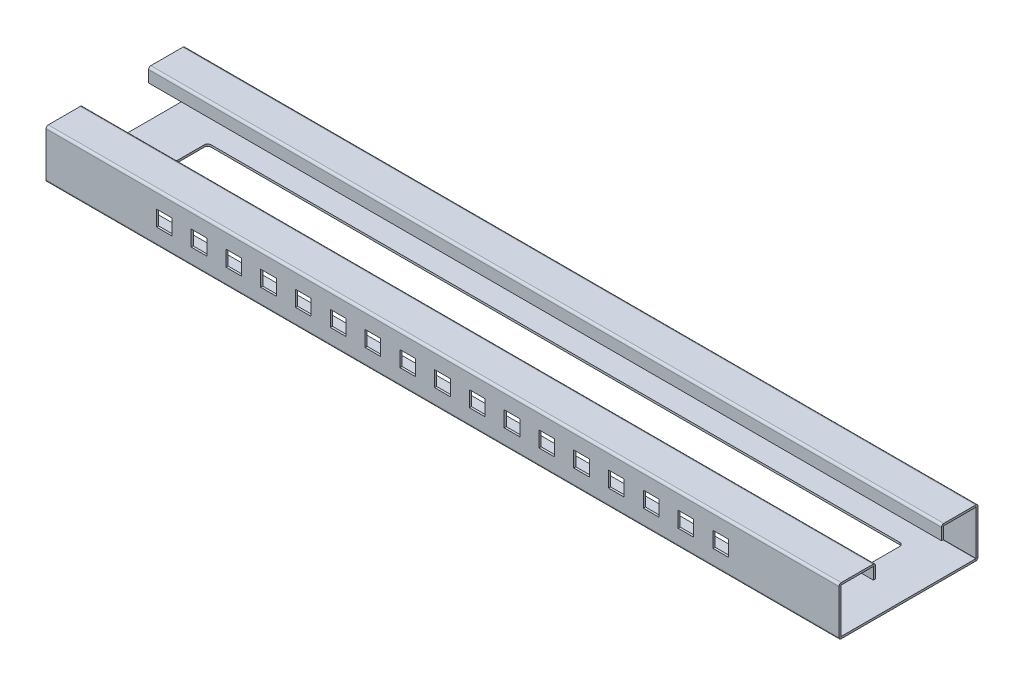
from build123d import *

# Parameters (mm, degrees)
SKETCH_1_W                         = 456
SKETCH_1_H                         = 80
SM_BASE_FLANGE_1_DEPTH             = 1.2
SM_EDGE_FLANGE_1_STRIP_W           = 5
SM_EDGE_FLANGE_1_STRIP_H           = 1.2
SM_EDGE_FLANGE_1_STRIP_CUT_DEPTH   = 456
SM_EDGE_FLANGE_1_STRIP_2_W         = 5
SM_EDGE_FLANGE_1_STRIP_2_H         = 1.2
SM_EDGE_FLANGE_1_STRIP_CUT_2_DEPTH = 456
SM_EDGE_FLANGE_1_DEPTH             = 456
SM_EDGE_FLANGE_1_BEND_DEPTH        = 456
SM_EDGE_FLANGE_2_STRIP_W           = 5
SM_EDGE_FLANGE_2_STRIP_H           = 1.2
SM_EDGE_FLANGE_2_STRIP_CUT_DEPTH   = 456
SM_EDGE_FLANGE_2_STRIP_2_W         = 5
SM_EDGE_FLANGE_2_STRIP_2_H         = 1.2
SM_EDGE_FLANGE_2_STRIP_CUT_2_DEPTH = 456
SM_EDGE_FLANGE_2_DEPTH             = 456
SM_EDGE_FLANGE_2_BEND_DEPTH        = 456
SKETCH_30_W                        = 400
SKETCH_30_H                        = 50
CUT_EXTRUDE_1_DEPTH                = 10
SM_EDGE_FLANGE_3_STRIP_W           = 5
SM_EDGE_FLANGE_3_STRIP_H           = 1.2
SM_EDGE_FLANGE_3_STRIP_CUT_DEPTH   = 456
SM_EDGE_FLANGE_3_STRIP_2_W         = 5
SM_EDGE_FLANGE_3_STRIP_2_H         = 1.2
SM_EDGE_FLANGE_3_STRIP_CUT_2_DEPTH = 456
SM_EDGE_FLANGE_3_DEPTH             = 456
SM_EDGE_FLANGE_3_BEND_DEPTH        = 456
FILLET_1_R                         = 2
SKETCH_40_W                        = 9
SKETCH_40_H                        = 9
CUT_EXTRUDE_2_DEPTH                = 244.109522644
PATTERN_LINEAR_1_COUNT             = 9
PATTERN_LINEAR_1_PITCH             = 20
PATTERN_LINEAR_1_COL_COUNT         = 9
PATTERN_LINEAR_1_COL_PITCH         = 20


# Sheet-metal steps are written as plain solids
with BuildPart() as part:
    # Sketch 1 → 基体-法兰1 (new body)
    with BuildSketch(Plane(origin=(0, 0, 0), x_dir=(1, 0, 0), z_dir=(0, 1, 0))):
        Rectangle(SKETCH_1_W, SKETCH_1_H)
    extrude(amount=-SM_BASE_FLANGE_1_DEPTH)

    # 边线-法兰1 strip (across the edge) → 边线-法兰1 strip cut (cut)
    with BuildSketch(Plane(origin=(-228, 0, 40), x_dir=(0, 0, -1), z_dir=(1, 0, 0))):
        with Locations((-1.2, -0.6)):
            Rectangle(SM_EDGE_FLANGE_1_STRIP_W, SM_EDGE_FLANGE_1_STRIP_H)
    extrude(amount=SM_EDGE_FLANGE_1_STRIP_CUT_DEPTH, mode=Mode.SUBTRACT)

    # 边线-法兰1 strip 2 (across the edge) → 边线-法兰1 strip cut 2 (cut)
    with BuildSketch(Plane(origin=(228, 0, -40), x_dir=(0, 0, 1), z_dir=(-1, 0, 0))):
        with Locations((-1.2, -0.6)):
            Rectangle(SM_EDGE_FLANGE_1_STRIP_2_W, SM_EDGE_FLANGE_1_STRIP_2_H)
    extrude(amount=SM_EDGE_FLANGE_1_STRIP_CUT_2_DEPTH, mode=Mode.SUBTRACT)

    # 边线-法兰1 section (across the edge) → 边线-法兰1 (add)
    with BuildSketch(Plane(origin=(-228, 0, 40), x_dir=(0, 0, -1), z_dir=(1, 0, 0))):
        with BuildLine():
            Line((0, 0.1), (0, 26.8))
            Line((0, 26.8), (1.2, 26.8))
            Line((1.2, 26.8), (1.2, 0.1))
            ThreePointArc((1.2, 0.1), (1.229289322, 0.029289322), (1.3, 0))
            Line((1.3, 0), (1.3, -1.2))
            ThreePointArc((1.3, -1.2), (0.380761184, -0.819238816), (0, 0.1))
        make_face()
    extrude(amount=SM_EDGE_FLANGE_1_DEPTH)

    # 边线-法兰1 section 2 (across the edge) → 边线-法兰1 bend (add)
    with BuildSketch(Plane(origin=(228, 0, -40), x_dir=(0, 0, 1), z_dir=(-1, 0, 0))):
        with BuildLine():
            Line((0, 0.1), (0, 26.8))
            Line((0, 26.8), (1.2, 26.8))
            Line((1.2, 26.8), (1.2, 0.1))
            ThreePointArc((1.2, 0.1), (1.229289322, 0.029289322), (1.3, 0))
            Line((1.3, 0), (1.3, -1.2))
            ThreePointArc((1.3, -1.2), (0.380761184, -0.819238816), (0, 0.1))
        make_face()
    extrude(amount=SM_EDGE_FLANGE_1_BEND_DEPTH)

    # 边线-法兰2 strip (across the edge) → 边线-法兰2 strip cut (cut)
    with BuildSketch(Plane(origin=(-228, 26.8, 38.8), x_dir=(0, -1, 0), z_dir=(1, 0, 0))):
        with Locations((-1.2, -0.6)):
            Rectangle(SM_EDGE_FLANGE_2_STRIP_W, SM_EDGE_FLANGE_2_STRIP_H)
    extrude(amount=SM_EDGE_FLANGE_2_STRIP_CUT_DEPTH, mode=Mode.SUBTRACT)

    # 边线-法兰2 strip 2 (across the edge) → 边线-法兰2 strip cut 2 (cut)
    with BuildSketch(Plane(origin=(228, 26.8, -38.8), x_dir=(0, -1, 0), z_dir=(-1, 0, 0))):
        with Locations((-1.2, -0.6)):
            Rectangle(SM_EDGE_FLANGE_2_STRIP_2_W, SM_EDGE_FLANGE_2_STRIP_2_H)
    extrude(amount=SM_EDGE_FLANGE_2_STRIP_CUT_2_DEPTH, mode=Mode.SUBTRACT)

    # 边线-法兰2 section (across the edge) → 边线-法兰2 (add)
    with BuildSketch(Plane(origin=(-228, 26.8, 38.8), x_dir=(0, -1, 0), z_dir=(1, 0, 0))):
        with BuildLine():
            Line((0, 0.1), (0, 19.8))
            Line((0, 19.8), (1.2, 19.8))
            Line((1.2, 19.8), (1.2, 0.1))
            ThreePointArc((1.2, 0.1), (1.229289322, 0.029289322), (1.3, 0))
            Line((1.3, 0), (1.3, -1.2))
            ThreePointArc((1.3, -1.2), (0.380761184, -0.819238816), (0, 0.1))
        make_face()
    extrude(amount=SM_EDGE_FLANGE_2_DEPTH)

    # 边线-法兰2 section 2 (across the edge) → 边线-法兰2 bend (add)
    with BuildSketch(Plane(origin=(228, 26.8, -38.8), x_dir=(0, -1, 0), z_dir=(-1, 0, 0))):
        with BuildLine():
            Line((0, 0.1), (0, 19.8))
            Line((0, 19.8), (1.2, 19.8))
            Line((1.2, 19.8), (1.2, 0.1))
            ThreePointArc((1.2, 0.1), (1.229289322, 0.029289322), (1.3, 0))
            Line((1.3, 0), (1.3, -1.2))
            ThreePointArc((1.3, -1.2), (0.380761184, -0.819238816), (0, 0.1))
        make_face()
    extrude(amount=SM_EDGE_FLANGE_2_BEND_DEPTH)

    # 草图30 → 切除-拉伸1 (cut)
    with BuildSketch(Plane(origin=(0, 0, 0), x_dir=(1, 0, 0), z_dir=(0, 1, 0))):
        Rectangle(SKETCH_30_W, SKETCH_30_H)
    extrude(amount=-CUT_EXTRUDE_1_DEPTH, mode=Mode.SUBTRACT)

    # 边线-法兰3 strip (across the edge) → 边线-法兰3 strip cut (cut)
    with BuildSketch(Plane(origin=(-228, 25.6, 19), x_dir=(0, 0, 1), z_dir=(1, 0, 0))):
        with Locations((-1.2, -0.6)):
            Rectangle(SM_EDGE_FLANGE_3_STRIP_W, SM_EDGE_FLANGE_3_STRIP_H)
    extrude(amount=SM_EDGE_FLANGE_3_STRIP_CUT_DEPTH, mode=Mode.SUBTRACT)

    # 边线-法兰3 strip 2 (across the edge) → 边线-法兰3 strip cut 2 (cut)
    with BuildSketch(Plane(origin=(228, 25.6, -19), x_dir=(0, 0, -1), z_dir=(-1, 0, 0))):
        with Locations((-1.2, -0.6)):
            Rectangle(SM_EDGE_FLANGE_3_STRIP_2_W, SM_EDGE_FLANGE_3_STRIP_2_H)
    extrude(amount=SM_EDGE_FLANGE_3_STRIP_CUT_2_DEPTH, mode=Mode.SUBTRACT)

    # 边线-法兰3 section (across the edge) → 边线-法兰3 (add)
    with BuildSketch(Plane(origin=(-228, 25.6, 19), x_dir=(0, 0, 1), z_dir=(1, 0, 0))):
        with BuildLine():
            Line((0, 0.1), (0, 6.8))
            Line((0, 6.8), (1.2, 6.8))
            Line((1.2, 6.8), (1.2, 0.1))
            ThreePointArc((1.2, 0.1), (1.229289322, 0.029289322), (1.3, 0))
            Line((1.3, 0), (1.3, -1.2))
            ThreePointArc((1.3, -1.2), (0.380761184, -0.819238816), (0, 0.1))
        make_face()
    extrude(amount=SM_EDGE_FLANGE_3_DEPTH)

    # 边线-法兰3 section 2 (across the edge) → 边线-法兰3 bend (add)
    with BuildSketch(Plane(origin=(228, 25.6, -19), x_dir=(0, 0, -1), z_dir=(-1, 0, 0))):
        with BuildLine():
            Line((0, 0.1), (0, 6.8))
            Line((0, 6.8), (1.2, 6.8))
            Line((1.2, 6.8), (1.2, 0.1))
            ThreePointArc((1.2, 0.1), (1.229289322, 0.029289322), (1.3, 0))
            Line((1.3, 0), (1.3, -1.2))
            ThreePointArc((1.3, -1.2), (0.380761184, -0.819238816), (0, 0.1))
        make_face()
    extrude(amount=SM_EDGE_FLANGE_3_BEND_DEPTH)

    # 圆角1
    fillet_1_edges = [part.edges().sort_by_distance(p)[0] for p in [
        (200, -0.6, -25),
        (200, -0.6, 25),
        (-200, -0.6, 25),
        (-200, -0.6, -25),
    ]]
    fillet(fillet_1_edges, radius=FILLET_1_R)

    # 草图40 → 切除-拉伸2 (cut, through all)
    with BuildSketch(Plane(origin=(0, 0, -40), x_dir=(-1, 0, 0), z_dir=(0, 0, -1))):
        with Locations((0, 12.8)):
            Rectangle(SKETCH_40_W, SKETCH_40_H)
    cut_extrude_2 = extrude(amount=-CUT_EXTRUDE_2_DEPTH, mode=Mode.SUBTRACT)

    # 阵列(线性)1: 切除-拉伸2 ×9
    with Locations(*[(-i * PATTERN_LINEAR_1_PITCH, 0, 0) for i in range(1, PATTERN_LINEAR_1_COUNT)]):
        add(cut_extrude_2, mode=Mode.SUBTRACT)

    # 阵列(线性)1 col: 切除-拉伸2 ×9
    with Locations(*[(i * PATTERN_LINEAR_1_COL_PITCH, 0, 0) for i in range(1, PATTERN_LINEAR_1_COL_COUNT)]):
        add(cut_extrude_2, mode=Mode.SUBTRACT)


solid = part.part
